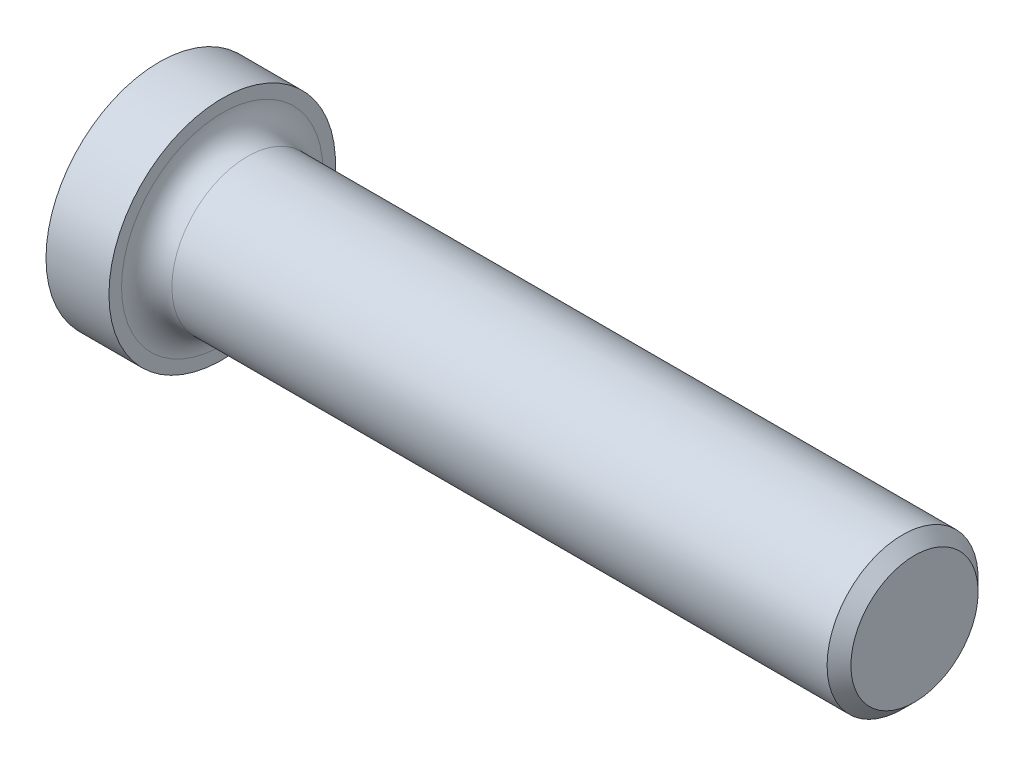
from build123d import *


# Read off the part's stored shape, not the designer's step: M12 机械螺纹 螺柱1
with BuildPart() as part:
    # 草图1 → 旋转1 (revolve)
    with BuildSketch(Plane.XY, mode=Mode.PRIVATE) as revolve_1_sk:
        with BuildLine():
            Line((60, 0), (60, 6))
            Line((60, 6), (7, 6))
            ThreePointArc((7, 6), (5.585786438, 6.585786438), (5, 8))
            Line((5, 8), (5, 9))
            Line((5, 9), (0, 9))
            ThreePointArc((0, 9), (-1.597221966, 4.625396092), (-2.139428901, 0))
            Line((-2.139428901, 0), (60, 0))
        make_face()
    revolve(revolve_1_sk.sketch.rotate(Axis((0, 0, 0), (1, 0, 0)), 90), axis=Axis((0, 0, 0), (1, 0, 0)))

    # M12 机械螺纹 螺柱1 outline → M12 机械螺纹 螺柱1 (revolve, cut)
    with BuildSketch(Plane.YX):
        Polygon((6, 60), (5.053, 60), (6, 59.053), align=None)
    revolve(axis=Axis((0, 0, 0), (1, 0, 0)), mode=Mode.SUBTRACT)


solid = part.part
